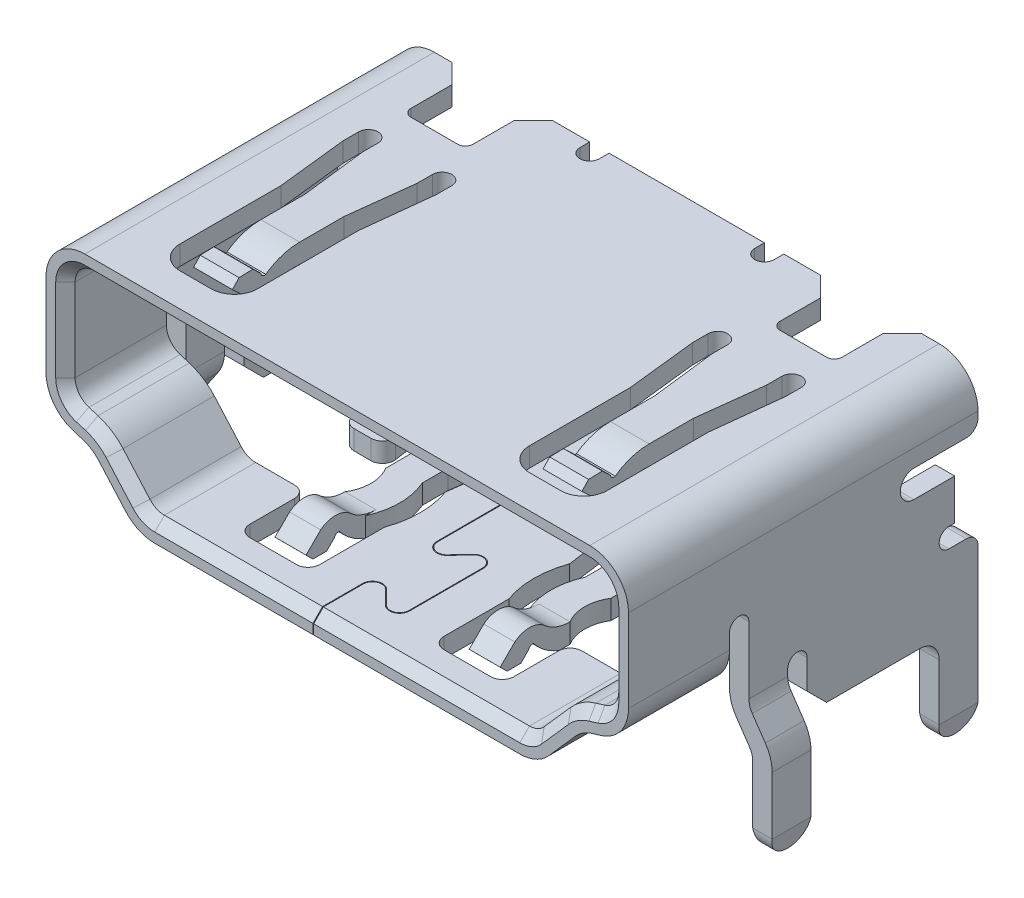
from build123d import *

# Parameters (mm, degrees)
RESSALTO_EXTRUS_O1_DEPTH      = 8.3
RESSALTO_EXTRUS_O1_DEPTH_BACK = 0.7
CHANFRO1_SIZE                 = 0.25
CORTE_EXTRUS_O1_DEPTH         = 3
RESSALTO_EXTRUS_O3_DEPTH      = 0.5
ESBO_O9_W                     = 0.5
ESBO_O9_H                     = 1
FILETE1_R                     = 0.499
FILETE1_OF_ESPELHAR3_R        = 0.499
CORTE_EXTRUS_O2_DEPTH         = 1
CORTE_EXTRUS_O3_DEPTH         = 1
CORTE_EXTRUS_O4_DEPTH         = 1
RESSALTO_EXTRUS_O4_DEPTH      = 0.8
RESSALTO_EXTRUS_O5_DEPTH      = 1
CORTE_EXTRUS_O5_DEPTH         = 11


with BuildPart() as part:
    # Esboço2 → Ressalto-extrusão1 (new, two sides: drawn at the far end of the back side and taken through both)
    with BuildSketch(Plane.XY.offset(-RESSALTO_EXTRUS_O1_DEPTH_BACK)):
        with BuildLine():
            Line((13.5, 2.775), (26.5, 2.775))
            ThreePointArc((26.5, 2.775), (27.207106781, 2.482106781), (27.5, 1.775))
            Line((27.5, 1.775), (27.5, -0.36))
            ThreePointArc((27.5, -0.36), (27.303276033, -0.95560693), (26.79050477, -1.316873544))
            Line((26.79050477, -1.316873544), (26.553545707, -1.388813811))
            ThreePointArc((26.553545707, -1.388813811), (26.328421757, -1.492872789), (26.140247155, -1.654425825))
            Line((26.140247155, -1.654425825), (25.449725383, -2.436749084))
            ThreePointArc((25.449725383, -2.436749084), (25.111248657, -2.686523199), (24.7, -2.775))
            Line((24.7, -2.775), (15.3, -2.775))
            ThreePointArc((15.3, -2.775), (14.888751343, -2.686523199), (14.550274617, -2.436749084))
            Line((14.550274617, -2.436749084), (13.859752845, -1.654425825))
            ThreePointArc((13.859752845, -1.654425825), (13.671578243, -1.492872789), (13.446454293, -1.388813811))
            Line((13.446454293, -1.388813811), (13.20949523, -1.316873544))
            ThreePointArc((13.20949523, -1.316873544), (12.696723967, -0.95560693), (12.5, -0.36))
            Line((12.5, -0.36), (12.5, 1.775))
            ThreePointArc((12.5, 1.775), (12.792893219, 2.482106781), (13.5, 2.775))
        make_face()
        with BuildLine():
            Line((13.5, 2.275), (26.5, 2.275))
            ThreePointArc((26.5, 2.275), (26.853553391, 2.128553391), (27, 1.775))
            Line((27, 1.775), (27, -0.36))
            ThreePointArc((27, -0.36), (26.901638017, -0.657803465), (26.645252385, -0.838436772))
            Line((26.645252385, -0.838436772), (26.408293321, -0.910377039))
            ThreePointArc((26.408293321, -0.910377039), (26.05810051, -1.072246561), (25.765384464, -1.323551283))
            Line((25.765384464, -1.323551283), (25.074862692, -2.105874542))
            ThreePointArc((25.074862692, -2.105874542), (24.905624329, -2.230761599), (24.7, -2.275))
            Line((24.7, -2.275), (15.3, -2.275))
            ThreePointArc((15.3, -2.275), (15.094375671, -2.230761599), (14.925137308, -2.105874542))
            Line((14.925137308, -2.105874542), (14.234615536, -1.323551283))
            ThreePointArc((14.234615536, -1.323551283), (13.94189949, -1.072246561), (13.591706679, -0.910377039))
            Line((13.591706679, -0.910377039), (13.354747615, -0.838436772))
            ThreePointArc((13.354747615, -0.838436772), (13.098361983, -0.657803465), (13, -0.36))
            Line((13, -0.36), (13, 1.775))
            ThreePointArc((13, 1.775), (13.146446609, 2.128553391), (13.5, 2.275))
        make_face(mode=Mode.SUBTRACT)
    extrude(amount=RESSALTO_EXTRUS_O1_DEPTH + RESSALTO_EXTRUS_O1_DEPTH_BACK)

    # Chanfro1
    chanfro1_edges = [part.edges().sort_by_distance(p)[0] for p in [
        (20, 2.275, 8.3),
        (13.146446609, 2.128553391, 8.3),
        (26.853553391, 2.128553391, 8.3),
        (13, 0.7075, 8.3),
        (27, 0.7075, 8.3),
        (13.098361983, -0.657803465, 8.3),
        (26.901638017, -0.657803465, 8.3),
        (13.473227147, -0.874406905, 8.3),
        (26.526772853, -0.874406905, 8.3),
        (13.94189949, -1.072246561, 8.3),
        (26.05810051, -1.072246561, 8.3),
        (14.579876422, -1.714712912, 8.3),
        (25.420123578, -1.714712912, 8.3),
        (15.094375671, -2.230761599, 8.3),
        (24.905624329, -2.230761599, 8.3),
        (20, -2.275, 8.3),
    ]]
    chamfer(chanfro1_edges, length=CHANFRO1_SIZE)

    # Esboço3 → Corte-extrusão1 (cut)
    with BuildSketch(Plane(origin=(27.5, 0, 0), x_dir=(0, 0, -1), z_dir=(1, 0, 0))):
        with BuildLine():
            Line((-5.7, 0.025), (-5.7, -4.040151325))
            Line((-5.7, -4.040151325), (-5.2, -4.040151325))
            Line((-5.2, -4.040151325), (1.122499897, -4.040151325))
            Line((1.122499897, -4.040151325), (1.122499897, -0.225))
            Line((1.122499897, -0.225), (1.122499897, 1.775))
            Line((1.122499897, 1.775), (0.7, 1.775))
            Line((0.7, 1.775), (0.7, 1.625))
            ThreePointArc((0.7, 1.625), (0.612132034, 1.412867966), (0.4, 1.325))
            Line((0.4, 1.325), (-0.95, 1.325))
            ThreePointArc((-0.95, 1.325), (-1.3, 0.975), (-0.95, 0.625))
            Line((-0.95, 0.625), (0.1, 0.625))
            Line((0.1, 0.625), (0.1, -0.225))
            Line((0.1, -0.225), (-5.2, -0.225))
            Line((-5.2, -0.225), (-5.2, 0.025))
            ThreePointArc((-5.2, 0.025), (-5.45, 0.275), (-5.7, 0.025))
        make_face()
    corte_extrus_o1 = extrude(amount=-CORTE_EXTRUS_O1_DEPTH, mode=Mode.SUBTRACT)

    # Espelhar1: Corte-extrusão1 across plane
    add(corte_extrus_o1.mirror(Plane.ZY.offset(-20)), mode=Mode.SUBTRACT)

    # Esboço6 → Ressalto-extrusão3 (add)
    with BuildSketch(Plane(origin=(27.5, 0, 0), x_dir=(0, 0, -1), z_dir=(1, 0, 0))):
        with BuildLine():
            Line((0.1, -0.225), (0.1, -0.425))
            Line((0.1, -0.425), (-0.05, -0.425))
            ThreePointArc((-0.05, -0.425), (-0.3, -0.675), (-0.05, -0.925))
            Line((-0.05, -0.925), (0.4, -0.925))
            ThreePointArc((0.4, -0.925), (0.612132034, -1.012867966), (0.7, -1.225))
            Line((0.7, -1.225), (0.7, -4.725))
            ThreePointArc((0.7, -4.725), (0.2, -5.225), (-0.3, -4.725))
            Line((-0.3, -4.725), (-0.3, -3.275))
            ThreePointArc((-0.3, -3.275), (-0.446446609, -2.921446609), (-0.8, -2.775))
            Line((-0.8, -2.775), (-3.2, -2.775))
            Line((-3.2, -2.775), (-3.7, -2.275))
            Line((-3.7, -2.275), (-3.7, -1.525))
            ThreePointArc((-3.7, -1.525), (-3.95, -1.275), (-4.2, -1.525))
            Line((-4.2, -1.525), (-4.2, -1.695))
            Line((-4.2, -1.695), (-5.2, -1.695))
            Line((-5.2, -1.695), (-5.2, -1.05080475))
            Line((-5.2, -1.05080475), (-5.2, -0.225))
            Line((-5.2, -0.225), (0.1, -0.225))
        make_face()
    ressalto_extrus_o3 = extrude(amount=-RESSALTO_EXTRUS_O3_DEPTH)

    # Espelhar2: Ressalto-extrusão3 across plane
    add(ressalto_extrus_o3.mirror(Plane.ZY.offset(-20)))

    # Varredura1: sweep along a path in Esboço8
    with BuildLine(Plane.XY.offset(5.2)) as varredura1_path:
        Line((27.849, -5.025), (27.849, -3.035))
        ThreePointArc((27.849, -3.035), (27.815578161, -2.813089059), (27.718, -2.611))
        Line((27.718, -2.611), (27.381, -2.119))
        ThreePointArc((27.381, -2.119), (27.283421839, -1.916910941), (27.25, -1.695))
    # Esboço9 → Varredura1 (sweep)
    with BuildSketch(Plane.XZ.offset(1.695)):
        with Locations((27.25, 4.7)):
            Rectangle(ESBO_O9_W, ESBO_O9_H)
    varredura1 = sweep(path=varredura1_path.line, transition=Transition.RIGHT)

    # Filete1
    filete1_edges = [part.edges().sort_by_distance(p)[0] for p in [
        (27.849, -5.025, 4.2),
        (27.849, -5.025, 5.2),
    ]]
    fillet(filete1_edges, radius=FILETE1_R)

    # Espelhar3: Varredura1 across plane
    add(varredura1.mirror(Plane.ZY.offset(-20)))

    # Filete1 of Espelhar3
    filete1_of_espelhar3_edges = [part.edges().sort_by_distance(p)[0] for p in [
        (12.151, -5.025, 4.2),
        (12.151, -5.025, 5.2),
    ]]
    fillet(filete1_of_espelhar3_edges, radius=FILETE1_OF_ESPELHAR3_R)

    # Esboço10 → Corte-extrusão2 (cut)
    with BuildSketch(Plane(origin=(0, 2.775, 0), x_dir=(1, 0, 0), z_dir=(0, 1, 0))):
        with BuildLine():
            Line((26.05, 0.7), (25.55, 0.2))
            Line((25.55, 0.2), (25.55, -0.85))
            ThreePointArc((25.55, -0.85), (25.491421356, -0.991421356), (25.35, -1.05))
            Line((25.35, -1.05), (24.15, -1.05))
            ThreePointArc((24.15, -1.05), (24.008578644, -0.991421356), (23.95, -0.85))
            Line((23.95, -0.85), (23.95, 0.2))
            Line((23.95, 0.2), (23.45, 0.7))
            Line((23.45, 0.7), (22.5, 0.7))
            Line((22.5, 0.7), (22.5, 0.45))
            ThreePointArc((22.5, 0.45), (22.25, 0.2), (22, 0.45))
            Line((22, 0.45), (22, 1.825806464))
            Line((22, 1.825806464), (26.05, 1.825806464))
            Line((26.05, 1.825806464), (26.05, 0.7))
        make_face()
        with BuildLine():
            Line((24.1, -7.45), (24.9, -7.45))
            ThreePointArc((24.9, -7.45), (25.324264069, -7.274264069), (25.5, -6.85))
            Line((25.5, -6.85), (25.5, -4.25))
            Line((25.5, -4.25), (25.7, -2.45))
            Line((25.7, -2.45), (25.7, -2.05))
            ThreePointArc((25.7, -2.05), (25.45, -1.8), (25.2, -2.05))
            Line((25.2, -2.05), (25.2, -2.45))
            Line((25.2, -2.45), (25, -4.13))
            Line((25, -4.13), (25, -4.25))
            Line((25, -4.25), (25, -5.2673))
            Line((25, -5.2673), (24, -5.2673))
            Line((24, -5.2673), (24, -4.25))
            Line((24, -4.25), (24, -4.13))
            Line((24, -4.13), (23.8, -2.45))
            Line((23.8, -2.45), (23.8, -2.05))
            ThreePointArc((23.8, -2.05), (23.55, -1.8), (23.3, -2.05))
            Line((23.3, -2.05), (23.3, -2.45))
            Line((23.3, -2.45), (23.5, -4.25))
            Line((23.5, -4.25), (23.5, -6.85))
            ThreePointArc((23.5, -6.85), (23.675735931, -7.274264069), (24.1, -7.45))
        make_face()
    corte_extrus_o2 = extrude(amount=-CORTE_EXTRUS_O2_DEPTH, mode=Mode.SUBTRACT)

    # Espelhar4: Corte-extrusão2 across plane
    add(corte_extrus_o2.mirror(Plane.ZY.offset(-20)), mode=Mode.SUBTRACT)

    # Esboço11 → Corte-extrusão3 (cut)
    with BuildSketch(Plane.XZ.offset(2.775)):
        with BuildLine():
            Line((15.5, 5.7), (16.3, 5.7))
            ThreePointArc((16.3, 5.7), (16.512132034, 5.787867966), (16.6, 6))
            Line((16.6, 6), (16.6, 7.15))
            ThreePointArc((16.6, 7.15), (16.687867966, 7.362132034), (16.9, 7.45))
            Line((16.9, 7.45), (18.1, 7.45))
            ThreePointArc((18.1, 7.45), (18.312132034, 7.362132034), (18.4, 7.15))
            Line((18.4, 7.15), (18.4, 5.482))
            ThreePointArc((18.4, 5.482), (18.537021498, 4.7), (18.4, 3.918))
            Line((18.4, 3.918), (18.6, 2.45))
            Line((18.6, 2.45), (18.6, 1.95))
            ThreePointArc((18.6, 1.95), (18.35, 1.7), (18.1, 1.95))
            Line((18.1, 1.95), (17.9, 3.35))
            Line((17.9, 3.35), (17.9, 4.01))
            ThreePointArc((17.9, 4.01), (18.055740215, 4.7424), (17.9, 5.4748))
            Line((17.9, 5.4748), (17.1, 5.4748))
            Line((17.1, 5.4748), (17.1, 5.2048))
            ThreePointArc((17.1, 5.2048), (17.249484511, 4.67885), (17.1, 4.1529))
            Line((17.1, 4.1529), (17.1, 3.3272))
            Line((17.1, 3.3272), (16.9105, 1.9257))
            ThreePointArc((16.9105, 1.9257), (16.6605, 1.6757), (16.4105, 1.9257))
            Line((16.4105, 1.9257), (16.4105, 2.4257))
            Line((16.4105, 2.4257), (16.5376, 3.3341))
            ThreePointArc((16.5376, 3.3341), (16.466861376, 3.572574941), (16.2405, 3.6757))
            Line((16.2405, 3.6757), (15.8106, 3.6757))
            ThreePointArc((15.8106, 3.6757), (15.598467966, 3.587832034), (15.5106, 3.3757))
            Line((15.5106, 3.3757), (15.5106, 1.3757))
            Line((15.5106, 1.3757), (16.0106, 0.8757))
            Line((16.0106, 0.8757), (17.7106, 0.8757))
            ThreePointArc((17.7106, 0.8757), (17.922732034, 0.787832034), (18.0106, 0.5757))
            Line((18.0106, 0.5757), (18.0106, 0.3757))
            ThreePointArc((18.0106, 0.3757), (18.098467966, 0.163567966), (18.3106, 0.0757))
            Line((18.3106, 0.0757), (20, 0.0757))
            Line((20, 0.0757), (20, -1.100530022))
            Line((20, -1.100530022), (14.919265786, -1.100530022))
            Line((14.919265786, -1.100530022), (14.919265786, 5.2048))
            Line((14.919265786, 5.2048), (15.5, 5.7))
        make_face()
    corte_extrus_o3 = extrude(amount=-CORTE_EXTRUS_O3_DEPTH, mode=Mode.SUBTRACT)

    # Espelhar5: Corte-extrusão3 across plane
    add(corte_extrus_o3.mirror(Plane.ZY.offset(-20)), mode=Mode.SUBTRACT)

    # Esboço12 → Corte-extrusão4 (cut)
    with BuildSketch(Plane.XZ.offset(2.775)):
        with BuildLine():
            Line((19.4106, -0.117707226), (19.4106, 1.3257))
            ThreePointArc((19.4106, 1.3257), (19.55986004, 1.547848771), (19.82196, 1.493698543))
            Line((19.82196, 1.493698543), (20.164857851, 1.143800735))
            ThreePointArc((20.164857851, 1.143800735), (20.448800933, 1.085135514), (20.6105, 1.325798543))
            Line((20.6105, 1.325798543), (20.6105, 3.2258))
            ThreePointArc((20.6105, 3.2258), (20.448803028, 3.46646363), (20.16486, 3.407801457))
            Line((20.16486, 3.407801457), (19.821957851, 3.057899265))
            ThreePointArc((19.821957851, 3.057899265), (19.559857945, 3.003752084), (19.4106, 3.225901457))
            Line((19.4106, 3.225901457), (19.4106, 5.1259))
            ThreePointArc((19.4106, 5.1259), (19.559797725, 5.348023312), (19.821865712, 5.293994643))
            Line((19.821865712, 5.293994643), (20.146784929, 4.944096638))
            ThreePointArc((20.146784929, 4.944096638), (20.430759842, 4.885310137), (20.59252107, 5.125998543))
            Line((20.59252107, 5.125998543), (20.59252107, 7.026))
            ThreePointArc((20.59252107, 7.026), (20.430824098, 7.26666363), (20.14688107, 7.208001457))
            Line((20.14688107, 7.208001457), (19.803978921, 6.858099265))
            ThreePointArc((19.803978921, 6.858099265), (19.541879015, 6.803952084), (19.39262107, 7.026101457))
            Line((19.39262107, 7.026101457), (19.39262107, 9.06575703))
            ThreePointArc((19.39262107, 9.06575703), (19.38262107, 9.07575703), (19.37262107, 9.06575703))
            Line((19.37262107, 9.06575703), (19.37262107, 7.026098543))
            ThreePointArc((19.37262107, 7.026098543), (19.534320137, 6.785435514), (19.818263219, 6.844100735))
            Line((19.818263219, 6.844100735), (20.16116107, 7.193998543))
            ThreePointArc((20.16116107, 7.193998543), (20.42326103, 7.248148771), (20.57252107, 7.026))
            Line((20.57252107, 7.026), (20.57252107, 5.126001457))
            ThreePointArc((20.57252107, 5.126001457), (20.423324019, 4.903876964), (20.161255358, 4.957905357))
            Line((20.161255358, 4.957905357), (19.836336141, 5.307803362))
            ThreePointArc((19.836336141, 5.307803362), (19.552360554, 5.366589588), (19.3906, 5.1259))
            Line((19.3906, 5.1259), (19.3906, 3.225898543))
            ThreePointArc((19.3906, 3.225898543), (19.552299067, 2.985235514), (19.836242149, 3.043900735))
            Line((19.836242149, 3.043900735), (20.17914, 3.393798543))
            ThreePointArc((20.17914, 3.393798543), (20.44123996, 3.447948771), (20.5905, 3.2258))
            Line((20.5905, 3.2258), (20.5905, 1.325801457))
            ThreePointArc((20.5905, 1.325801457), (20.441242055, 1.103652084), (20.179142149, 1.157799265))
            Line((20.179142149, 1.157799265), (19.83624, 1.507701457))
            ThreePointArc((19.83624, 1.507701457), (19.552296972, 1.56636363), (19.3906, 1.3257))
            Line((19.3906, 1.3257), (19.3906, -0.117707226))
            ThreePointArc((19.3906, -0.117707226), (19.4006, -0.127707226), (19.4106, -0.117707226))
        make_face()
    extrude(amount=-CORTE_EXTRUS_O4_DEPTH, mode=Mode.SUBTRACT)

    # Esboço14 → Ressalto-extrusão4 (add)
    with BuildSketch(Plane(origin=(22.9, 0, 0), x_dir=(0, 0, -1), z_dir=(1, 0, 0))):
        with BuildLine():
            Line((-5.2048, -2.275), (-5.2048, -2.775))
            Line((-5.2048, -2.775), (-5.4748, -2.775))
            ThreePointArc((-5.4748, -2.775), (-5.841679986, -2.580565027), (-6.1412, -2.293))
            ThreePointArc((-6.1412, -2.293), (-6.224464799, -2.298955914), (-6.2742, -2.366))
            Line((-6.2742, -2.366), (-6.4736, -2.5647))
            Line((-6.4736, -2.5647), (-6.8272, -2.5647))
            Line((-6.8272, -2.5647), (-7.0036, -2.3876))
            Line((-7.0036, -2.3876), (-6.627, -2.0125))
            ThreePointArc((-6.627, -2.0125), (-6.219665294, -1.882151027), (-5.829, -2.0562))
            ThreePointArc((-5.829, -2.0562), (-5.535514016, -2.218702692), (-5.2048, -2.275))
        make_face()
    ressalto_extrus_o4 = extrude(amount=-RESSALTO_EXTRUS_O4_DEPTH)

    # Esboço15 → Ressalto-extrusão5 (add)
    with BuildSketch(Plane(origin=(25, 0, 0), x_dir=(0, 0, -1), z_dir=(1, 0, 0))):
        with BuildLine():
            Line((-5.2673, 2.275), (-5.2673, 2.775))
            ThreePointArc((-5.2673, 2.775), (-5.726561738, 2.702927261), (-6.1417, 2.4937))
            ThreePointArc((-6.1417, 2.4937), (-6.224873413, 2.506754104), (-6.2686, 2.5787))
            Line((-6.2686, 2.5787), (-6.475, 2.7735))
            Line((-6.475, 2.7735), (-6.8284, 2.7633))
            Line((-6.8284, 2.7633), (-7, 2.5815))
            Line((-7, 2.5815), (-6.6118, 2.2151))
            ThreePointArc((-6.6118, 2.2151), (-6.240173676, 2.052824535), (-5.8502, 2.164))
            ThreePointArc((-5.8502, 2.164), (-5.56717269, 2.263730503), (-5.2673, 2.275))
        make_face()
    ressalto_extrus_o5 = extrude(amount=-RESSALTO_EXTRUS_O5_DEPTH)

    # Espelhar6: Ressalto-extrusão4, Ressalto-extrusão5 across plane
    add(ressalto_extrus_o4.mirror(Plane.ZY.offset(-20)))
    add(ressalto_extrus_o5.mirror(Plane.ZY.offset(-20)))

    # Esboço16 → Corte-extrusão5 (cut)
    with BuildSketch(Plane.XY.offset(5.2)):
        Polygon((28.099, -4.526), (27.999, -5.025), (27.699, -5.025), (27.599, -4.526), (27.555323028, -4.526), (27.5, -4.725), (27.4, -5.225), (27.1, -5.225), (27, -4.725), (26.815237852, -4.725), (26.815237852, -5.379816457), (28.2402866, -5.379816457), (28.2402866, -4.526), align=None)
    corte_extrus_o5 = extrude(amount=-CORTE_EXTRUS_O5_DEPTH, mode=Mode.SUBTRACT)

    # Espelhar7: Corte-extrusão5 across plane
    add(corte_extrus_o5.mirror(Plane.ZY.offset(-20)), mode=Mode.SUBTRACT)


solid = part.part
